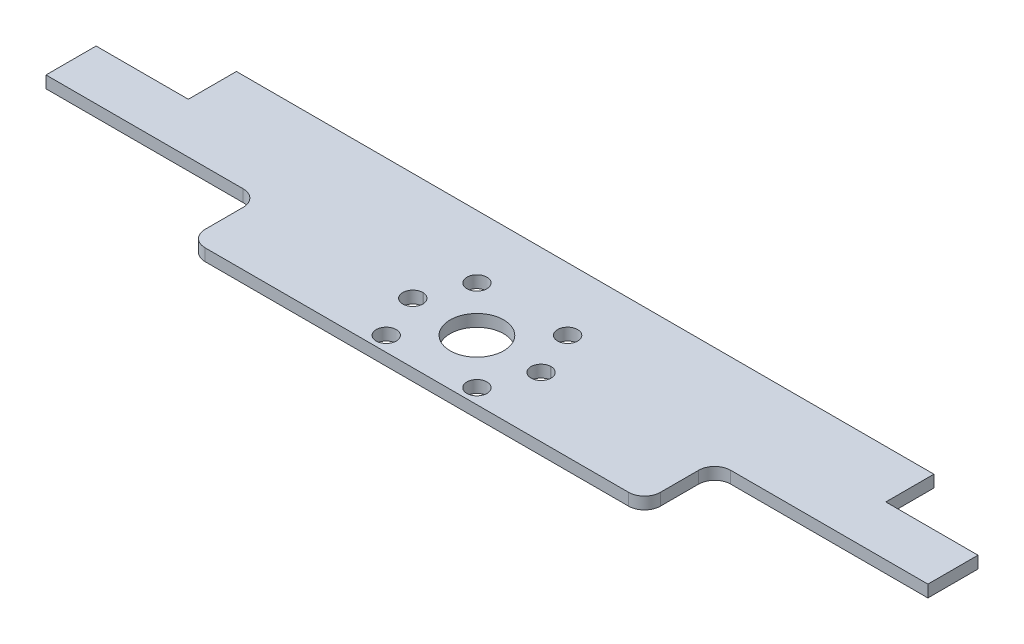
from build123d import *

# Parameters (mm, degrees)
SKETCH_2_R      = 2.5
SKETCH_2_R_2    = 6.682030953
EXTRUDE_1_DEPTH = 3
FILLET_1_R      = 4


with BuildPart() as part:
    # 草图2 → 凸台-拉伸1 (new body)
    with BuildSketch(Plane(origin=(0, 0, 0), x_dir=(1, 0, 0), z_dir=(0, 1, 0))):
        Polygon((56.805521657, -9.248304321), (110, -9.248304321), (110, 3.251695679), (87, 3.251695679), (87, 15.251695679), (-87, 15.251695679), (-87, 3.251695679), (-110, 3.251695679), (-110, -9.248304321), (-56.805521657, -9.248304321), (-56.805521657, -26.748304321), (56.805521657, -26.748304321), align=None)
        with BuildLine():
            Line((15.803480629, -9.248304321), (16, -9.248304321))
            ThreePointArc((16, -9.248304321), (16.097730955, -14.246393323), (15.8046875, -9.255945393))
            ThreePointArc((15.8046875, -9.255945393), (15.804084526, -9.252124784), (15.803480629, -9.248304321))
        make_face(mode=Mode.SUBTRACT)
        with Locations((11.313708499, -0.434595822)):
            Circle(SKETCH_2_R, mode=Mode.SUBTRACT)
        with Locations((11.313708499, -23.06201282)):
            Circle(SKETCH_2_R, mode=Mode.SUBTRACT)
        with Locations((0, -11.748304321)):
            Circle(SKETCH_2_R_2, mode=Mode.SUBTRACT)
        with Locations((-11.3137085, -0.434595822)):
            Circle(SKETCH_2_R, mode=Mode.SUBTRACT)
        with BuildLine():
            Line((-15.999999978, -9.248304321), (-15.803480629, -9.248304321))
            ThreePointArc((-15.803480629, -9.248304321), (-15.804084526, -9.252124784), (-15.8046875, -9.255945394))
            ThreePointArc((-15.8046875, -9.255945394), (-16.097730968, -14.246393322), (-15.999999978, -9.248304322))
        make_face(mode=Mode.SUBTRACT)
        with Locations((-11.313708499, -23.062012821)):
            Circle(SKETCH_2_R, mode=Mode.SUBTRACT)
    extrude(amount=EXTRUDE_1_DEPTH)

    # 圆角1
    fillet_1_edges = [part.edges().sort_by_distance(p)[0] for p in [
        (56.805521657, 1.5, 9.248304321),
        (56.805521657, 1.5, 26.748304321),
        (-56.805521657, 1.5, 9.248304321),
        (-56.805521657, 1.5, 26.748304321),
    ]]
    fillet(fillet_1_edges, radius=FILLET_1_R)


solid = part.part
